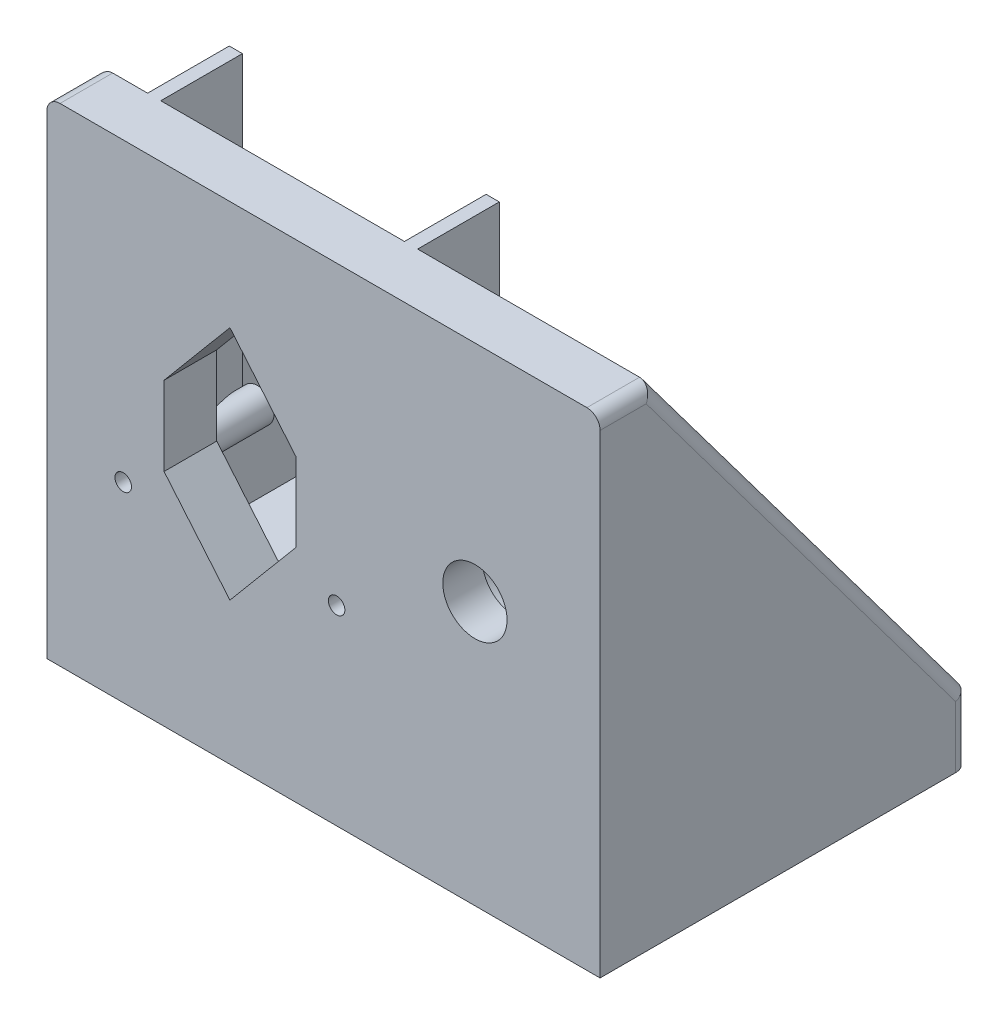
from build123d import *
from build123d.topology import SkipClean

# Parameters (mm, degrees)
SKETCH1_W                           = 42
SKETCH1_H                           = 28
BOSS_EXTRUDE1_DEPTH                 = 5
SKETCH2_W                           = 42
SKETCH2_H                           = 4
BOSS_EXTRUDE2_DEPTH                 = 32
TAP_DRILL_FOR_M1_6X0_35_TAP1_D      = 1.25
M3_CLEARANCE_HOLE1_D                = 3.4
BOSS_EXTRUDE3_DEPTH                 = 2.5
BOSS_EXTRUDE4_DEPTH                 = 2.5
FILLET2_R                           = 1
SKETCH9_R                           = 3.25
CUT_EXTRUDE1_DEPTH                  = 1
SKETCH10_R                          = 2.44
CUT_EXTRUDE2_DEPTH                  = 62.302528496
SKETCH11_R                          = 0.625
BOSS_EXTRUDE5_DEPTH                 = 6.2
CUT_EXTRUDE3_DEPTH                  = 61.901559914
BOSS_EXTRUDE6_REACH                 = 64.586
BOSS_EXTRUDE8_START                 = 7
SKETCH16_R                          = 4.75
SKETCH16_R_2                        = 3.25
BOSS_EXTRUDE8_DEPTH                 = 7
SKETCH17_R                          = 1.5
CUT_EXTRUDE4_DEPTH                  = 0.5
TAP_DRILL_FOR_M1_6X0_35_TAP2_REACH  = 58.001
TAP_DRILL_FOR_M1_6X0_35_TAP2_BORE_R = 0.625
SKETCH21_W                          = 2
SKETCH21_H                          = 8
CUT_EXTRUDE5_DEPTH                  = 6.2


with BuildPart() as part:
    # Sketch1 → Boss-Extrude1 (new body)
    with BuildSketch(Plane(origin=(0, 0, 0), x_dir=(1, 0, 0), z_dir=(0, 1, 0))):
        with Locations((21, 14)):
            Rectangle(SKETCH1_W, SKETCH1_H)
    extrude(amount=BOSS_EXTRUDE1_DEPTH)

    # Sketch2 → Boss-Extrude2 (add)
    with BuildSketch(Plane(origin=(0, 5, 0), x_dir=(1, 0, 0), z_dir=(0, 1, 0))):
        with Locations((21, 2)):
            Rectangle(SKETCH2_W, SKETCH2_H)
    extrude(amount=BOSS_EXTRUDE2_DEPTH)

    # Tap Drill for M1.6x0.35 Tap1 (through all)
    with Locations(Plane(origin=(0, 0, -4), x_dir=(-1, 0, 0), z_dir=(0, 0, -1))):
        with Locations((-22, 14.5), (-5.8, 14.5)):
            Hole(TAP_DRILL_FOR_M1_6X0_35_TAP1_D / 2)

    # M3 Clearance Hole1 (through all)
    with Locations(Plane(origin=(0, 5, 0), x_dir=(1, 0, 0), z_dir=(0, 1, 0))):
        with Locations((15.5, 23), (30.5, 23), (30.5, 10), (15.5, 10)):
            Hole(M3_CLEARANCE_HOLE1_D / 2)

    # Sketch7 → Boss-Extrude3 (add)
    with BuildSketch(Plane.ZY):
        Polygon((-28, 5), (-4, 37), (-4, 5), align=None)
    extrude(amount=-BOSS_EXTRUDE3_DEPTH)

    # Sketch8 → Boss-Extrude4 (add)
    with BuildSketch(Plane(origin=(42, 0, 0), x_dir=(0, 0, -1), z_dir=(1, 0, 0))):
        Polygon((28, 5), (4, 37), (4, 5), align=None)
    extrude(amount=-BOSS_EXTRUDE4_DEPTH)

    # Fillet2
    fillet2_edges = [part.edges().sort_by_distance(p)[0] for p in [
        (0, 37, -2),
        (42, 37, -2),
        (2.5, 21, -16),
        (0, 21, -16),
        (39.5, 21, -16),
        (42, 21, -16),
        (0, 2.5, -28),
        (42, 2.5, -28),
    ]]
    fillet(fillet2_edges, radius=FILLET2_R)

    # Sketch9 → Cut-Extrude1 (cut)
    with BuildSketch(Plane(origin=(0, 0, -4), x_dir=(-1, 0, 0), z_dir=(0, 0, -1))):
        with Locations((-32.5, 20)):
            Circle(SKETCH9_R)
    extrude(amount=-CUT_EXTRUDE1_DEPTH, mode=Mode.SUBTRACT)

    # Sketch10 → Cut-Extrude2 (cut, through all)
    with BuildSketch(Plane(origin=(0, 0, -3), x_dir=(-1, 0, 0), z_dir=(0, 0, -1))):
        with Locations((-32.5, 20)):
            Circle(SKETCH10_R)
    extrude(amount=-CUT_EXTRUDE2_DEPTH, mode=Mode.SUBTRACT)

    # Sketch11 → Boss-Extrude5 (add)
    # profile 1 of 2: a face of its own
    with SkipClean():  # the faces are left unmerged after this step: merging them gives an invalid solid
        with BuildSketch(Plane(origin=(0, 0, -4), x_dir=(-1, 0, 0), z_dir=(0, 0, -1))):
            with BuildLine():
                Line((-3.65, 37), (-4.65, 37))
                Line((-4.65, 37), (-4.65, 14.989897949))
                ThreePointArc((-4.65, 14.989897949), (-7.05, 14.5), (-4.65, 14.010102051))
                Line((-4.65, 14.010102051), (-3.65, 14.010102051))
                Line((-3.65, 14.010102051), (-3.65, 37))
            make_face()
            with Locations((-5.8, 14.5)):
                Circle(SKETCH11_R, mode=Mode.SUBTRACT)
        # profile 2 of 2: a face of its own
        with BuildSketch(Plane(origin=(0, 0, -4), x_dir=(-1, 0, 0), z_dir=(0, 0, -1))):
            with BuildLine():
                Line((-24.15, 37), (-23.15, 37))
                Line((-23.15, 37), (-23.15, 14.989897949))
                ThreePointArc((-23.15, 14.989897949), (-20.75, 14.5), (-23.15, 14.010102051))
                Line((-23.15, 14.010102051), (-24.15, 14.010102051))
                Line((-24.15, 14.010102051), (-24.15, 37))
            make_face()
            with Locations((-22, 14.5)):
                Circle(SKETCH11_R, mode=Mode.SUBTRACT)
        extrude(amount=BOSS_EXTRUDE5_DEPTH)
    add(part.part.scale(1), mode=Mode.REPLACE)  # the faces are merged on a copy

    # Sketch13 → Cut-Extrude3 (cut, through all)
    with BuildSketch(Plane(origin=(0, 0, -4), x_dir=(-1, 0, 0), z_dir=(0, 0, -1))):
        Polygon((-13.9, 28.708767963), (-8.9, 22.75), (-8.9, 16.75), (-13.9, 10.791232037), (-18.9, 16.75), (-18.9, 22.75), align=None)
    extrude(amount=-CUT_EXTRUDE3_DEPTH, mode=Mode.SUBTRACT)

    # Sketch14 → Boss-Extrude6 (add, up to next)
    with BuildSketch(Plane(origin=(0, 37, 0), x_dir=(1, 0, 0), z_dir=(0, 1, 0)), mode=Mode.PRIVATE) as boss_extrude6_sk1:
        Polygon((23.15, 10.2), (21.15, 4), (23.15, 4), align=None)
    boss_extrude6_tool1 = extrude(boss_extrude6_sk1.sketch, amount=-BOSS_EXTRUDE6_REACH, mode=Mode.PRIVATE) - part.part
    # Sketch14 → Boss-Extrude6 (add, up to next)
    with BuildSketch(Plane(origin=(0, 37, 0), x_dir=(1, 0, 0), z_dir=(0, 1, 0)), mode=Mode.PRIVATE) as boss_extrude6_sk2:
        Polygon((4.65, 10.2), (6.65, 4), (4.65, 4), align=None)
    boss_extrude6_tool2 = extrude(boss_extrude6_sk2.sketch, amount=-BOSS_EXTRUDE6_REACH, mode=Mode.PRIVATE) - part.part
    add(boss_extrude6_tool1.solids().sort_by_distance((22.483333, 37, -6.066667))[0])
    add(boss_extrude6_tool2.solids().sort_by_distance((5.316667, 37, -6.066667))[0])

    # Sketch16 → Boss-Extrude8 (add)
    with SkipClean():  # the faces are left unmerged after this step: merging them gives an invalid solid
        with BuildSketch(Plane(origin=(0, 0, -4), x_dir=(-1, 0, 0), z_dir=(0, 0, -1)).offset(BOSS_EXTRUDE8_START)):
            with Locations(Location((-32.5, 20, 0), (0, 0, 180))):
                Circle(SKETCH16_R)
            with Locations((-32.5, 20)):
                Circle(SKETCH16_R_2, mode=Mode.SUBTRACT)
        extrude(amount=-BOSS_EXTRUDE8_DEPTH)

    # Sketch17 → Cut-Extrude4 (cut)
    with SkipClean():  # the faces are left unmerged after this step: merging them gives an invalid solid
        with BuildSketch(Plane(origin=(0, 24.75, 0), x_dir=(1, 0, 0), z_dir=(0, 1, 0))):
            with Locations(Location((32.5, 8.1, 0), (0, 0, 270))):
                Circle(SKETCH17_R)
        extrude(amount=-CUT_EXTRUDE4_DEPTH, mode=Mode.SUBTRACT)

    # Tap Drill for M1.6x0.35 Tap2 bore → Tap Drill for M1.6x0.35 Tap2 (cut, up to next)
    with BuildSketch(Plane(origin=(0, 24.25, 0), x_dir=(1, 0, 0), z_dir=(0, 1, 0)), mode=Mode.PRIVATE) as tap_drill_for_m1_6x0_35_tap2_sk1:
        with Locations((32.5, 8.1)):
            Circle(TAP_DRILL_FOR_M1_6X0_35_TAP2_BORE_R)
    tap_drill_for_m1_6x0_35_tap2_tool1 = extrude(tap_drill_for_m1_6x0_35_tap2_sk1.sketch, amount=-TAP_DRILL_FOR_M1_6X0_35_TAP2_REACH, mode=Mode.PRIVATE) & part.part
    add(tap_drill_for_m1_6x0_35_tap2_tool1.solids().sort_by_distance((32.5, 24.25, -8.1))[0], mode=Mode.SUBTRACT)

    # Sketch21 → Cut-Extrude5 (cut)
    with BuildSketch(Plane(origin=(0, 0, -10.2), x_dir=(-1, 0, 0), z_dir=(0, 0, -1))):
        with Locations((-5.65, 33)):
            Rectangle(SKETCH21_W, SKETCH21_H)
        with Locations((-22.15, 33)):
            Rectangle(SKETCH21_W, SKETCH21_H)
    extrude(amount=-CUT_EXTRUDE5_DEPTH, mode=Mode.SUBTRACT)


solid = part.part
